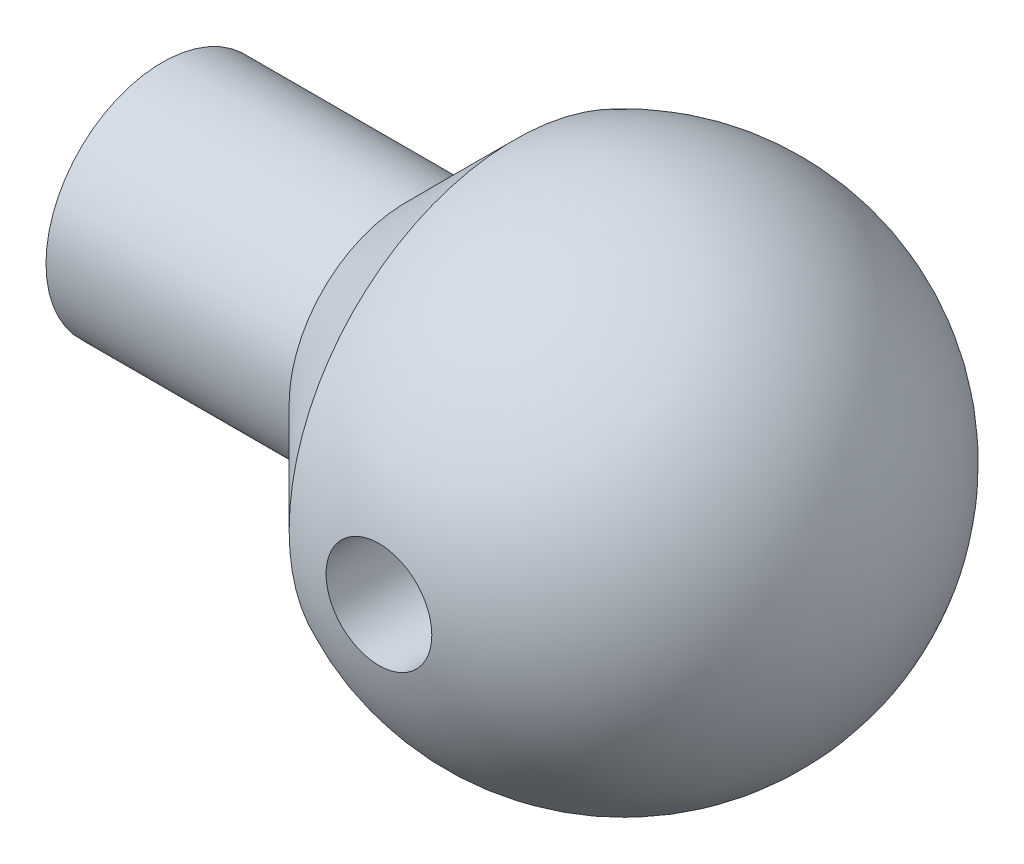
from build123d import *

# Parameters (mm, degrees)
CUT_EXTRUDE_1_DEPTH      = 25.366329598
CUT_EXTRUDE_1_DEPTH_BACK = 25.366329598
SKETCH_8_R               = 1.5
SCALE_1_SCALE            = 4.46


with BuildPart() as part:
    # 草图1 → 旋转1 (revolve)
    with BuildSketch(Plane.XY):
        with BuildLine():
            Line((0, 0), (1.982840043, -3.3))
            Line((1.982840043, -3.3), (8.882840043, -3.3))
            Line((8.882840043, -3.3), (11.982840043, -6.4))
            ThreePointArc((11.982840043, -6.4), (18.859419057, -6.025566442), (22.194098722, 0))
            Line((22.194098722, 0), (0, 0))
        make_face()
    revolve(axis=Axis((0, 0, 0), (1, 0, 0)))

    # 草图8 → 切除-拉伸1 (cut, two sides: drawn at the far end of the back side and taken through both)
    with BuildSketch(Plane.XY.offset(-CUT_EXTRUDE_1_DEPTH_BACK)):
        with Locations((15.082840043, 0)):
            Circle(SKETCH_8_R)
    extrude(amount=CUT_EXTRUDE_1_DEPTH + CUT_EXTRUDE_1_DEPTH_BACK, mode=Mode.SUBTRACT)


with BuildPart() as part_1:
    # 缩放比例1: scaled about (13.658797494, -7.6e-08, 0)
    add(part.part.scale(SCALE_1_SCALE).moved(Location((-47.259439329, 2.63e-07, 0))))


solid = part_1.part
